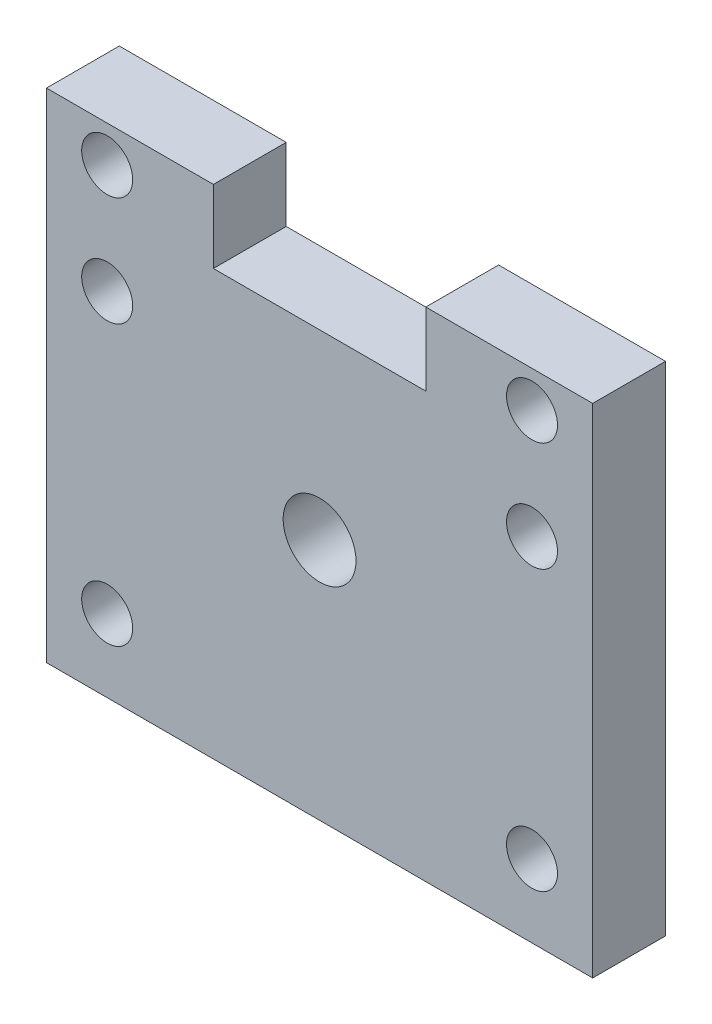
from build123d import *

# Parameters (mm, degrees)
SKETCH1_W                  = 90
SKETCH1_H                  = 82
BOSS_EXTRUDE1_DEPTH        = 6
M8_CLEARANCE_HOLE1_D       = 8.4
CUT_EXTRUDE1_DEPTH         = 94.728330829
CUT_EXTRUDE1_DEPTH_BACK    = 12
SKETCH6_W                  = 35
SKETCH6_H                  = 12
F_12_0_12_DIAMETER_HOLE1_D = 12


with BuildPart() as part:
    # Sketch1 → Boss-Extrude1 (new, symmetric)
    with BuildSketch(Plane.XY):
        Rectangle(SKETCH1_W, SKETCH1_H)
    extrude(amount=BOSS_EXTRUDE1_DEPTH, both=True)

    # M8 Clearance Hole1 (through all)
    with Locations(Plane.XY.offset(6)):
        with Locations((-35, 17), (35, 17), (35, -29), (-35, -29), (-35, 35), (35, 35)):
            Hole(M8_CLEARANCE_HOLE1_D / 2)

    # Sketch6 → Cut-Extrude1 (cut, two sides: drawn at the far end of the back side and taken through both)
    with BuildSketch(Plane(origin=(0, 41, 0), x_dir=(1, 0, 0), z_dir=(0, 1, 0)).offset(-CUT_EXTRUDE1_DEPTH_BACK)):
        Rectangle(SKETCH6_W, SKETCH6_H)
    extrude(amount=CUT_EXTRUDE1_DEPTH + CUT_EXTRUDE1_DEPTH_BACK, mode=Mode.SUBTRACT)

    # Ø12.0 (12) Diameter Hole1 (through all)
    with Locations(Plane.XY.offset(6)):
        with Locations((0, -1)):
            Hole(F_12_0_12_DIAMETER_HOLE1_D / 2)


solid = part.part
